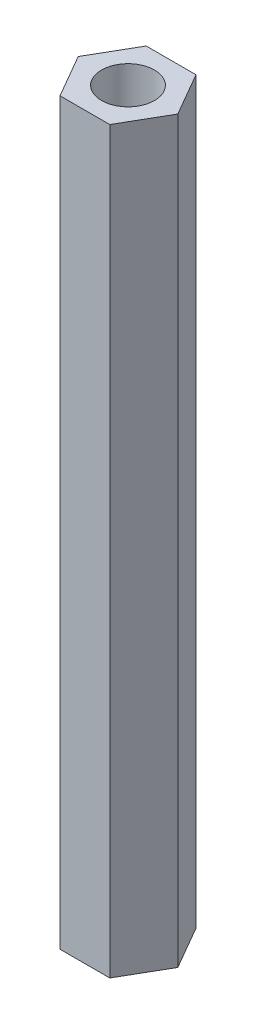
from build123d import *

# Parameters (mm, degrees)
SKETCH1_R           = 2.15
BOSS_EXTRUDE1_DEPTH = 60


with BuildPart() as part:
    # Sketch1 → Boss-Extrude1 (new body)
    with BuildSketch(Plane(origin=(0, 0, 0), x_dir=(1, 0, 0), z_dir=(0, 1, 0))):
        Polygon((4.041451884, 0), (2.020725942, 3.5), (-2.020725942, 3.5), (-4.041451884, 0), (-2.020725942, -3.5), (2.020725942, -3.5), align=None)
        Circle(SKETCH1_R, mode=Mode.SUBTRACT)
    extrude(amount=BOSS_EXTRUDE1_DEPTH)


solid = part.part
